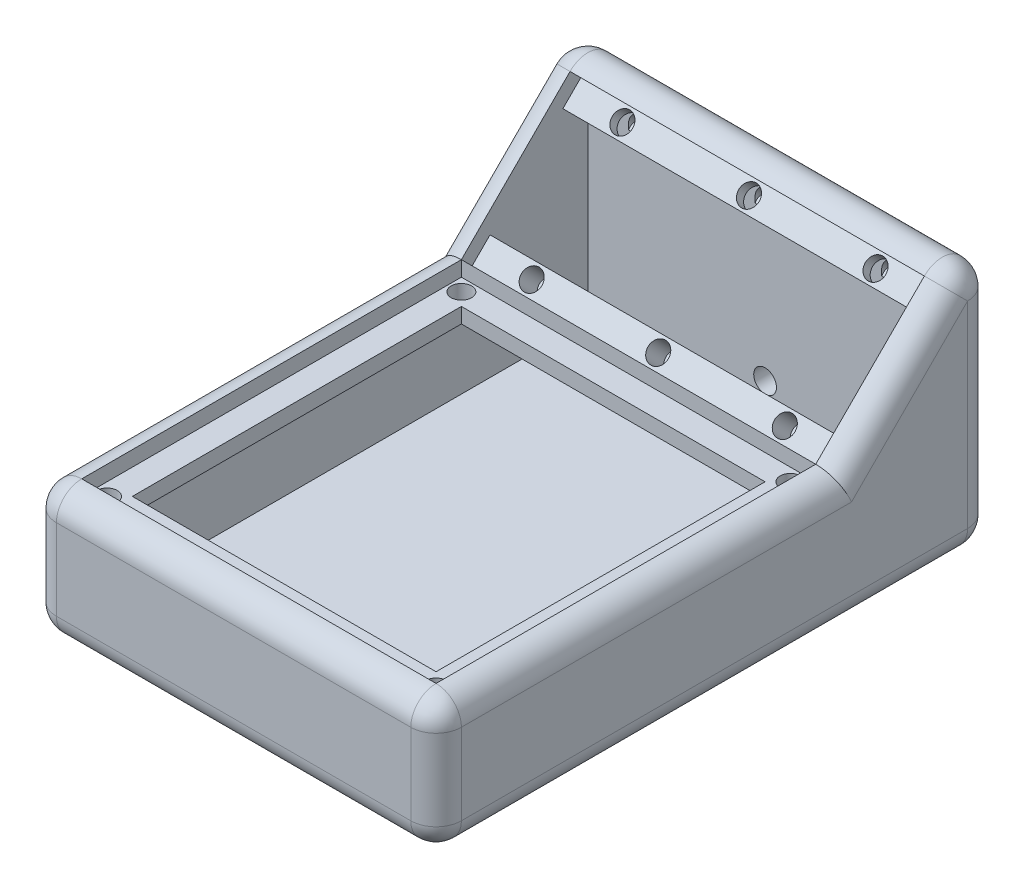
from build123d import *

# Parameters (mm, degrees)
SKETCH_1_W          = 80
SKETCH_1_H          = 110
EXTRUDE_1_DEPTH     = 26
EXTRUDE_2_DEPTH     = 80
FILLET_1_R          = 5
SKETCH_4_W          = 70
SKETCH_4_H          = 100
CUT_EXTRUDE_1_DEPTH = 20
CUT_EXTRUDE_2_REACH = 129.08
SKETCH_6_W          = 70
SKETCH_6_H          = 30.355339059
SKETCH_8_W          = 60
SKETCH_8_H          = 65
CUT_EXTRUDE_3_DEPTH = 20
SKETCH_9_W          = 70
SKETCH_9_H          = 8.485281375
EXTRUDE_3_DEPTH     = 5
SKETCH_11_W         = 70
SKETCH_11_H         = 5
EXTRUDE_4_DEPTH     = 5
SKETCH_13_W         = 70
SKETCH_13_H         = 75
CUT_EXTRUDE_4_DEPTH = 3
SKETCH_14_W         = 70
SKETCH_14_H         = 30.355339059
CUT_EXTRUDE_5_DEPTH = 3
SKETCH_15_W         = 70
SKETCH_15_H         = 3
EXTRUDE_5_DEPTH     = 100
SKETCH_16_R         = 2.025
CUT_EXTRUDE_6_DEPTH = 5
SKETCH_17_R         = 2.025
CUT_EXTRUDE_7_DEPTH = 5
SKETCH_18_R         = 2.25
CUT_EXTRUDE_8_DEPTH = 45


with BuildPart() as part:
    # 草圖1 → 填料-伸長1 (new body)
    with BuildSketch(Plane(origin=(0, 0, 0), x_dir=(1, 0, 0), z_dir=(0, 1, 0))):
        with Locations((31.755319149, -8.712765957)):
            Rectangle(SKETCH_1_W, SKETCH_1_H)
    extrude(amount=EXTRUDE_1_DEPTH)

    # 草圖2 → 填料-伸長2 (add)
    with BuildSketch(Plane(origin=(71.755319149, 0, 0), x_dir=(0, 0, -1), z_dir=(1, 0, 0))):
        Polygon((46.287234043, 26), (46.287234043, 56), (16.287234043, 26), align=None)
    extrude(amount=-EXTRUDE_2_DEPTH)

    # 圓角1
    fillet_1_edges = [part.edges().sort_by_distance(p)[0] for p in [
        (31.755319149, 26, 63.712765957),
        (71.755319149, 26, 23.712765957),
        (71.755319149, 41, -31.287234043),
        (-8.244680851, 41, -31.287234043),
        (31.755319149, 56, -46.287234043),
        (-8.244680851, 26, 23.712765957),
        (31.755319149, 0, -46.287234043),
        (-8.244680851, 28, -46.287234043),
        (-8.244680851, 0, 8.712765957),
        (71.755319149, 28, -46.287234043),
        (71.755319149, 0, 8.712765957),
        (-8.244680851, 13, 63.712765957),
        (71.755319149, 13, 63.712765957),
        (31.755319149, 0, 63.712765957),
    ]]
    fillet(fillet_1_edges, radius=FILLET_1_R)

    # 草圖4 → 除料-伸長1 (cut)
    with BuildSketch(Plane.XZ):
        with Locations((31.755319149, 8.712765957)):
            Rectangle(SKETCH_4_W, SKETCH_4_H)
    extrude(amount=-CUT_EXTRUDE_1_DEPTH, mode=Mode.SUBTRACT)

    # 除料-伸長2: up to this plane
    cut_extrude_2_end = Plane(origin=(0, 0, -41.287234043), z_dir=(0, 0, -1))
    # 草圖6 → 除料-伸長2 (cut, up to the surface)
    with BuildSketch(Plane(origin=(0, 4.856382979, 4.856382979), x_dir=(1, 0, 0), z_dir=(0, 0.7071067811865439, 0.7071067811865511)), mode=Mode.PRIVATE) as cut_extrude_2_sk1:
        with Locations((31.755319149, 45.079259479)):
            Rectangle(SKETCH_6_W, SKETCH_6_H)
    cut_extrude_2_tool1 = split(extrude(cut_extrude_2_sk1.sketch, amount=-CUT_EXTRUDE_2_REACH, mode=Mode.PRIVATE), bisect_by=cut_extrude_2_end, keep=Keep.BOTH, mode=Mode.PRIVATE)
    add(cut_extrude_2_tool1.solids().sort_by_distance((31.755319, 36.732233, -27.019467))[0], mode=Mode.SUBTRACT)

    # 草圖8 → 除料-伸長3 (cut)
    with BuildSketch(Plane(origin=(0, 26, 0), x_dir=(1, 0, 0), z_dir=(0, 1, 0))):
        with Locations((31.755319149, -21.212765957)):
            Rectangle(SKETCH_8_W, SKETCH_8_H)
    extrude(amount=-CUT_EXTRUDE_3_DEPTH, mode=Mode.SUBTRACT)

    # 草圖9 → 填料-伸長3 (add)
    with BuildSketch(Plane(origin=(0, 21.143617021, -21.143617021), x_dir=(1, 0, 0), z_dir=(0, 0.7071067811865511, -0.707106781186544))):
        with Locations((31.755319149, -2.625321985)):
            Rectangle(SKETCH_9_W, SKETCH_9_H)
    extrude(amount=EXTRUDE_3_DEPTH)

    # 草圖11 → 填料-伸長4 (add)
    with BuildSketch(Plane(origin=(0, 42.608083115, -42.608083115), x_dir=(1, 0, 0), z_dir=(0, -0.7071067811865511, 0.707106781186544))):
        with Locations((31.755319149, 4.367962673)):
            Rectangle(SKETCH_11_W, SKETCH_11_H)
    extrude(amount=EXTRUDE_4_DEPTH)

    # 草圖13 → 除料-伸長4 (cut)
    with BuildSketch(Plane(origin=(0, 26, 0), x_dir=(1, 0, 0), z_dir=(0, 1, 0))):
        with Locations((31.755319149, -21.212765957)):
            Rectangle(SKETCH_13_W, SKETCH_13_H)
    extrude(amount=-CUT_EXTRUDE_4_DEPTH, mode=Mode.SUBTRACT)

    # 草圖14 → 除料-伸長5 (cut)
    with BuildSketch(Plane(origin=(0, 4.856382979, 4.856382979), x_dir=(1, 0, 0), z_dir=(0, 0.7071067811865441, 0.7071067811865509))):
        with Locations((31.755319149, 45.079259479)):
            Rectangle(SKETCH_14_W, SKETCH_14_H)
    extrude(amount=-CUT_EXTRUDE_5_DEPTH, mode=Mode.SUBTRACT)

    # 草圖15 → 填料-伸長5 (add)
    with BuildSketch(Plane.XY.offset(-41.287234043)):
        with Locations((31.755319149, 1.5)):
            Rectangle(SKETCH_15_W, SKETCH_15_H)
    extrude(amount=EXTRUDE_5_DEPTH)

    # 草圖16 → 除料-伸長6 (cut)
    with BuildSketch(Plane(origin=(0, 2.735062635, 2.735062635), x_dir=(1, 0, 0), z_dir=(0, 0.7071067811865444, 0.7071067811865508))):
        with Locations((6.755319149, 57.756929008)):
            Circle(SKETCH_16_R)
        with Locations((56.755319149, 57.756929008)):
            Circle(SKETCH_16_R)
        with Locations((31.755319149, 57.756929008)):
            Circle(SKETCH_16_R)
        with Locations((6.755319149, 32.401589949)):
            Circle(SKETCH_16_R)
        with Locations((56.755319149, 32.401589949)):
            Circle(SKETCH_16_R)
        with Locations((31.755319149, 32.401589949)):
            Circle(SKETCH_16_R)
    extrude(amount=-CUT_EXTRUDE_6_DEPTH, mode=Mode.SUBTRACT)

    # 草圖17 → 除料-伸長7 (cut)
    with BuildSketch(Plane(origin=(0, 23, 0), x_dir=(1, 0, 0), z_dir=(0, 1, 0))):
        with Locations((-0.744680851, 13.787234043)):
            Circle(SKETCH_17_R)
        with Locations((64.255319149, -56.212765957)):
            Circle(SKETCH_17_R)
        with Locations((-0.744680851, -56.212765957)):
            Circle(SKETCH_17_R)
        with Locations((64.255319149, 13.787234043)):
            Circle(SKETCH_17_R)
    extrude(amount=-CUT_EXTRUDE_7_DEPTH, mode=Mode.SUBTRACT)

    # 草圖18 → 除料-伸長8 (cut)
    with BuildSketch(Plane(origin=(0, 0, -46.287234043), x_dir=(-1, 0, 0), z_dir=(0, 0, -1))):
        with Locations((-31.755319149, 10.25)):
            Circle(SKETCH_18_R)
    extrude(amount=-CUT_EXTRUDE_8_DEPTH, mode=Mode.SUBTRACT)


solid = part.part
